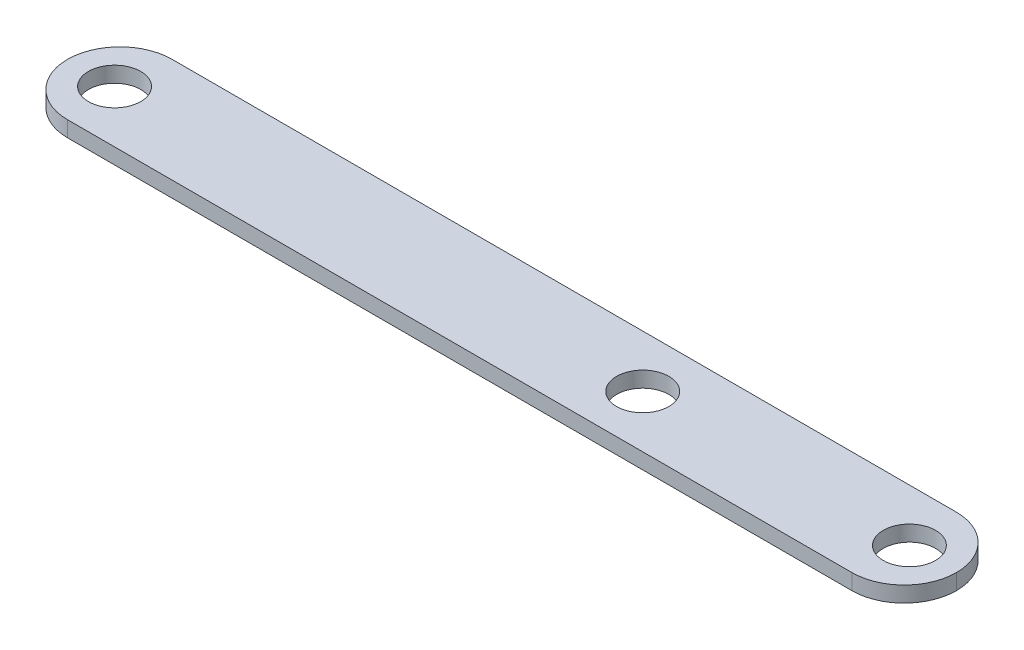
from build123d import *

# Parameters (mm, degrees)
SKETCH2_W           = 170
SKETCH2_H           = 20
BOSS_EXTRUDE1_DEPTH = 3
SKETCH3_R           = 5
CUT_EXTRUDE1_DEPTH  = 172.198714948
SKETCH4_R           = 5
CUT_EXTRUDE2_DEPTH  = 172.198714948
FILLET1_R           = 10
FILLET2_R           = 10
SKETCH5_R           = 5
CUT_EXTRUDE3_DEPTH  = 172.198714948


with BuildPart() as part:
    # Sketch2 → Boss-Extrude1 (new body)
    with BuildSketch(Plane(origin=(0, 0, 0), x_dir=(1, 0, 0), z_dir=(0, 1, 0))):
        with Locations((85, 10)):
            Rectangle(SKETCH2_W, SKETCH2_H)
    extrude(amount=BOSS_EXTRUDE1_DEPTH)

    # Sketch3 → Cut-Extrude1 (cut, through all)
    with BuildSketch(Plane(origin=(0, 3, 0), x_dir=(1, 0, 0), z_dir=(0, 1, 0))):
        with Locations(Location((9, 10, 0), (0, 0, 270))):
            Circle(SKETCH3_R)
    extrude(amount=-CUT_EXTRUDE1_DEPTH, mode=Mode.SUBTRACT)

    # Sketch4 → Cut-Extrude2 (cut, through all)
    with BuildSketch(Plane(origin=(0, 3, 0), x_dir=(1, 0, 0), z_dir=(0, 1, 0))):
        with Locations(Location((161, 10, 0), (0, 0, 270))):
            Circle(SKETCH4_R)
    extrude(amount=-CUT_EXTRUDE2_DEPTH, mode=Mode.SUBTRACT)

    # Fillet1
    fillet1_edges = [part.edges().sort_by_distance(p)[0] for p in [
        (0, 1.5, -20),
        (0, 1.5, 0),
    ]]
    fillet(fillet1_edges, radius=FILLET1_R - 0.0001)  # a hair under: the kernel refuses the full size

    # Fillet2
    fillet2_edges = [part.edges().sort_by_distance(p)[0] for p in [
        (170, 1.5, -20),
        (170, 1.5, 0),
    ]]
    fillet(fillet2_edges, radius=FILLET2_R - 0.0001)  # a hair under: the kernel refuses the full size

    # Sketch5 → Cut-Extrude3 (cut, through all)
    with BuildSketch(Plane(origin=(0, 3, 0), x_dir=(1, 0, 0), z_dir=(0, 1, 0))):
        with Locations(Location((110, 10, 0), (0, 0, 270))):
            Circle(SKETCH5_R)
    extrude(amount=-CUT_EXTRUDE3_DEPTH, mode=Mode.SUBTRACT)


solid = part.part
